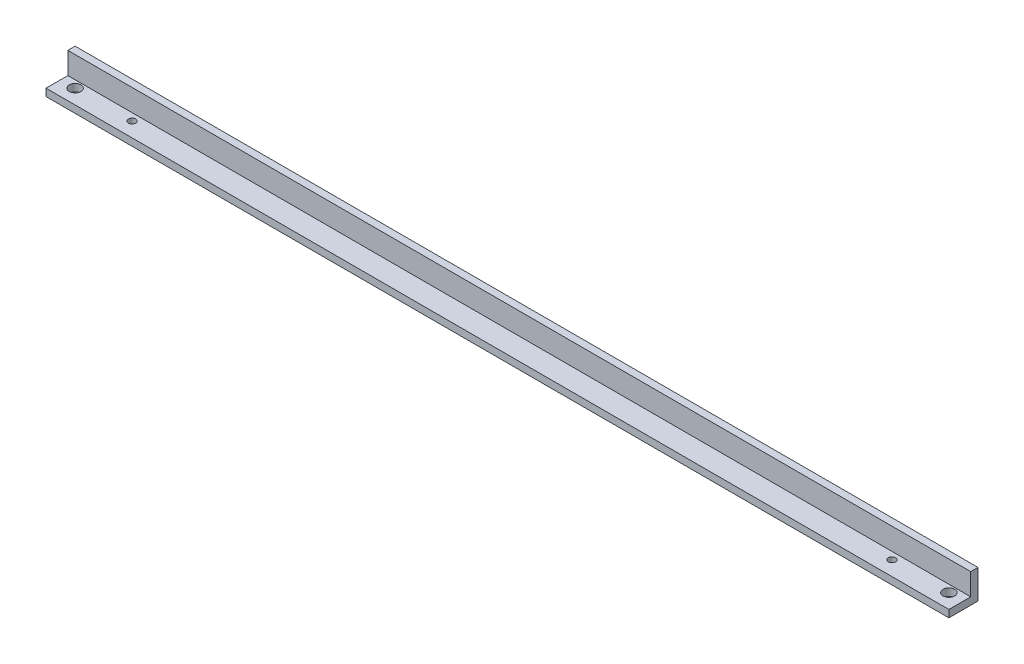
from build123d import *

# Parameters (mm, degrees)
BOSS_EXTRUDE1_DEPTH = 787.4
SKETCH2_R           = 5.08
SKETCH2_R_2         = 3.175
CUT_EXTRUDE1_DEPTH  = 914.4


with BuildPart() as part:
    # Sketch1 → Boss-Extrude1 (new body)
    with BuildSketch(Plane(origin=(0, 0, 0), x_dir=(0, 0, -1), z_dir=(1, 0, 0))):
        Polygon((0, 0), (0, 19.05), (6.35, 19.05), (6.35, -6.35), (-19.05, -6.35), (-19.05, 0), align=None)
    extrude(amount=BOSS_EXTRUDE1_DEPTH)

    # Sketch2 → Cut-Extrude1 (cut)
    with BuildSketch(Plane.XZ.offset(6.35)):
        with Locations((12.7, 6.35)):
            Circle(SKETCH2_R)
        with Locations((62.357, 6.35)):
            Circle(SKETCH2_R_2)
        with Locations((725.043, 6.35)):
            Circle(SKETCH2_R_2)
        with Locations((774.7, 6.35)):
            Circle(SKETCH2_R)
    extrude(amount=-CUT_EXTRUDE1_DEPTH, mode=Mode.SUBTRACT)


solid = part.part
